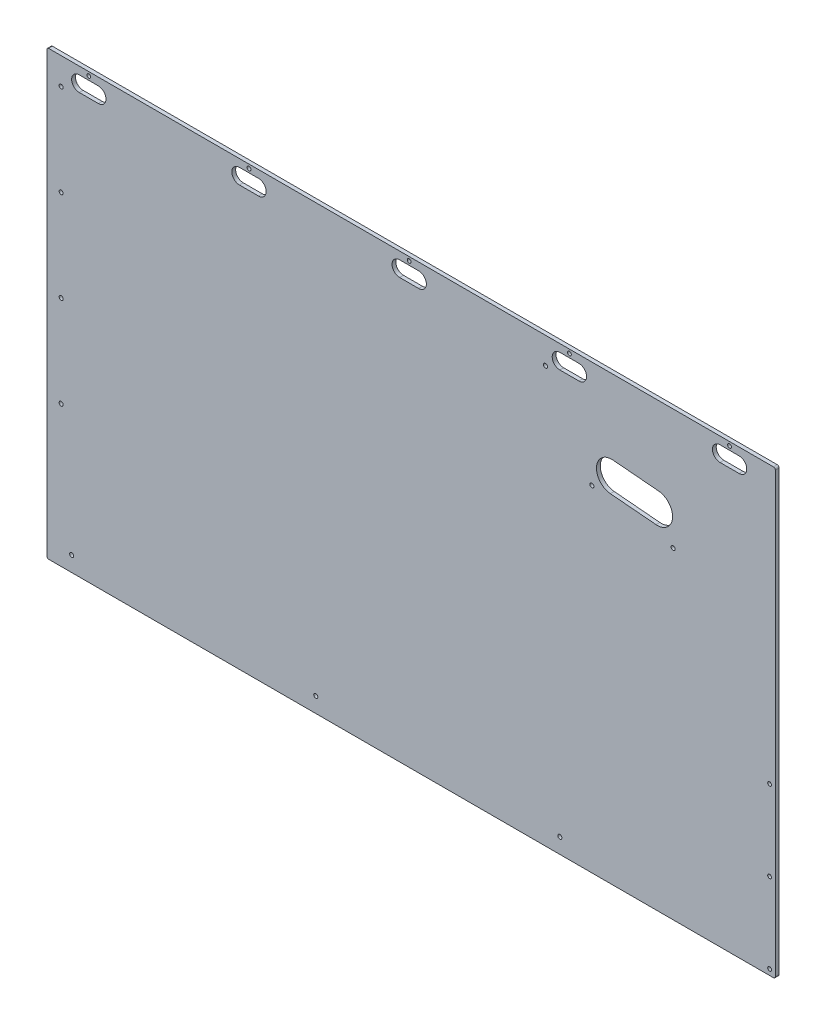
from build123d import *

# Parameters (mm, degrees)
SKETCH1_W                   = 1212.85
SKETCH1_H                   = 736.6
BOSS_EXTRUDE1_DEPTH         = 6.35
H_0_266_DIAMETER_HOLE1_D    = 6.7564
H_0_266_DIAMETER_HOLE2_D    = 6.7564
H_0_266_DIAMETER_HOLE3_D    = 6.7564
SKETCH12_R                  = 3.175
CUT_EXTRUDE4_DEPTH          = 710.532587782
LPATTERN1_COUNT             = 5
LPATTERN1_PITCH             = 266.7
FILLET2_R                   = 3.175
CUT_EXTRUDE5_DEPTH          = 710.532587782
F_1_4_0_25_DIAMETER_HOLE1_D = 6.35


with BuildPart() as part:
    # Sketch1 → Boss-Extrude1 (new body)
    with BuildSketch(Plane.XY):
        Rectangle(SKETCH1_W, SKETCH1_H)
    extrude(amount=BOSS_EXTRUDE1_DEPTH)

    # H (0.266) Diameter Hole1 (through all)
    with Locations(Plane.XY.offset(6.35)):
        with Locations((-565.15, -342.9), (-158.75, -342.9), (247.65, -342.9)):
            Hole(H_0_266_DIAMETER_HOLE1_D / 2)

    # H (0.266) Diameter Hole2 (through all)
    with Locations(Plane.XY.offset(6.35)):
        with Locations((-582.6125, 323.596), (-582.6125, 171.196), (-582.6125, 18.796), (-582.6125, -133.604)):
            Hole(H_0_266_DIAMETER_HOLE2_D / 2)

    # H (0.266) Diameter Hole3 (through all)
    with Locations(Plane.XY.offset(6.35)):
        with Locations((223.770762516, 324.305909426), (436.157706379, 167.711380386), (301.059782944, 190.437399177)):
            Hole(H_0_266_DIAMETER_HOLE3_D / 2)

    # Sketch12 → Cut-Extrude4 (cut, through all)
    with BuildSketch(Plane.XY.offset(6.35)):
        with Locations((-536.575, 361.95)):
            Circle(SKETCH12_R)
        with BuildLine():
            Line((-552.45, 355.6), (-520.7, 355.6))
            ThreePointArc((-520.7, 355.6), (-508, 342.9), (-520.7, 330.2))
            Line((-520.7, 330.2), (-552.45, 330.2))
            ThreePointArc((-552.45, 330.2), (-565.15, 342.9), (-552.45, 355.6))
        make_face()
    cut_extrude4 = extrude(amount=-CUT_EXTRUDE4_DEPTH, mode=Mode.SUBTRACT)

    # LPattern1: Cut-Extrude4 ×5
    with Locations(*[(i * LPATTERN1_PITCH, 0, 0) for i in range(1, LPATTERN1_COUNT)]):
        add(cut_extrude4, mode=Mode.SUBTRACT)

    # Fillet2
    fillet2_edges = [part.edges().sort_by_distance(p)[0] for p in [
        (606.425, 368.3, 3.175),
        (606.425, -368.3, 3.175),
        (-606.425, -368.3, 3.175),
        (-606.425, 368.3, 3.175),
    ]]
    fillet(fillet2_edges, radius=FILLET2_R)

    # Sketch14 → Cut-Extrude5 (cut, through all)
    with BuildSketch(Plane.XY.offset(6.35)):
        with BuildLine():
            Line((336.240912114, 244.52397913), (412.150948109, 237.882711533))
            ThreePointArc((412.150948109, 237.882711533), (435.240537575, 210.365610336), (407.723436378, 187.27602087))
            Line((407.723436378, 187.27602087), (331.813400383, 193.917288467))
            ThreePointArc((331.813400383, 193.917288467), (308.723810917, 221.434389664), (336.240912114, 244.52397913))
        make_face()
    extrude(amount=-CUT_EXTRUDE5_DEPTH, mode=Mode.SUBTRACT)

    # 1/4 (0.25) Diameter Hole1 (through all)
    with Locations(Plane.XY.offset(6.35)):
        with Locations((596.9, -358.775), (596.9, -225.425), (596.9, -92.075)):
            Hole(F_1_4_0_25_DIAMETER_HOLE1_D / 2)


solid = part.part
